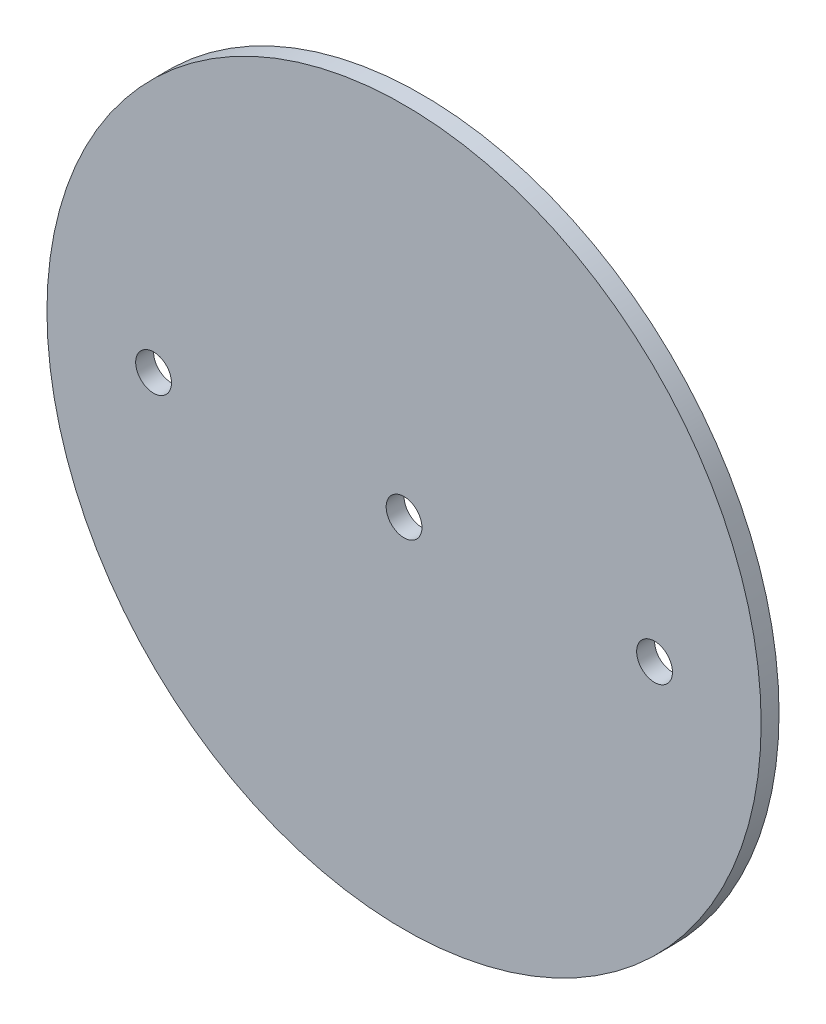
from build123d import *

# Parameters (mm, degrees)
SKETCH1_R                   = 63.373
BOSS_EXTRUDE1_DEPTH         = 1.5875
F_1_4_0_25_DIAMETER_HOLE1_D = 6.35


with BuildPart() as part:
    # Sketch1 → Boss-Extrude1 (new, symmetric)
    with BuildSketch(Plane.XY):
        Circle(SKETCH1_R)
    extrude(amount=BOSS_EXTRUDE1_DEPTH, both=True)

    # 1/4 (0.25) Diameter Hole1 (through all)
    with Locations(Plane.XY.offset(1.5875)):
        with Locations((-44.45, 0), (0, 0), (44.45, 0)):
            Hole(F_1_4_0_25_DIAMETER_HOLE1_D / 2)


solid = part.part
